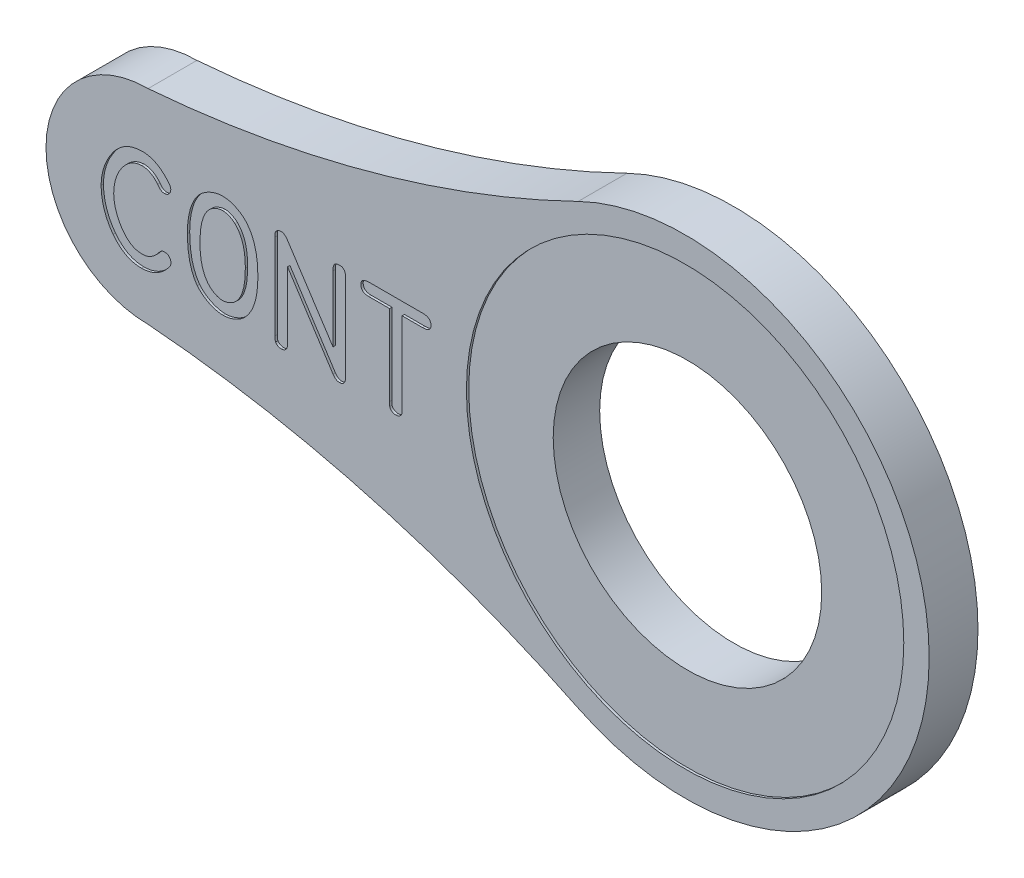
from build123d import *

# Parameters (mm, degrees)
BOSS_EXTRUDE1_DEPTH              = 1.5875
F_11_32_0_34375_DIAMETER_HOLE1_D = 8.73125
WRAP1_START                      = -0.0762
WRAP1_OUTLINE_R                  = 7.112
WRAP1_DEPTH                      = 0.0762


# Read off the part's stored shape, not the designer's step: Wrap1
with BuildPart() as part:
    # Sketch1 → Boss-Extrude1 (new body)
    with BuildSketch(Plane.XY):
        with BuildLine():
            ThreePointArc((-3.478640359, -7.13463156), (7.9375, 0), (-3.478640359, 7.13463156))
            ThreePointArc((-3.478640359, 7.13463156), (-10.291365431, 4.570684756), (-17.4625, 3.320934733))
            ThreePointArc((-17.4625, 3.320934733), (-20.783434733, 0), (-17.4625, -3.320934733))
            ThreePointArc((-17.4625, -3.320934733), (-10.291365431, -4.570684756), (-3.478640359, -7.13463156))
        make_face()
    extrude(amount=BOSS_EXTRUDE1_DEPTH)

    # 11/32 (0.34375) Diameter Hole1 (through all)
    with Locations(Plane.XY.offset(1.5875)):
        with Locations((0, 0)):
            Hole(F_11_32_0_34375_DIAMETER_HOLE1_D / 2)

    # Wrap1 outline → Wrap1 (cut)
    # profile 1 of 5: a face of its own
    with BuildSketch(Plane.XY.offset(1.5875).offset(WRAP1_START)):
        with BuildLine():
            Line((-9.202524652, 1.051753066), (-8.53708701, 1.051753066))
            add(Edge.make_bspline(
                [(-8.53708701, 1.051753066), (-8.515550018, 1.051915675), (-8.475328705, 1.052219355), (-8.419049158, 1.060872222), (-8.371032058, 1.075239414), (-8.331569886, 1.097349422), (-8.300354923, 1.12553967), (-8.279017568, 1.161093566), (-8.26539795, 1.202370334), (-8.26463823, 1.232205427), (-8.264238858, 1.247889249)],
                knots=[0, 0, 0, 0, 0.168067011, 0.313872781, 0.443458735, 0.557405365, 0.664641403, 0.767970584, 0.878025924, 1, 1, 1, 1], degree=3))
            add(Edge.make_bspline(
                [(-8.264238858, 1.247889249), (-8.264893612, 1.264540266), (-8.266131504, 1.296021014), (-8.28003294, 1.339524592), (-8.299700008, 1.377589847), (-8.329830253, 1.407446153), (-8.366946634, 1.431227712), (-8.412175956, 1.447111159), (-8.464950449, 1.457317493), (-8.502705889, 1.458486652), (-8.522878128, 1.459111319)],
                knots=[0, 0, 0, 0, 0.130829317, 0.247348531, 0.357249001, 0.465448022, 0.577582241, 0.702495907, 0.841047445, 1, 1, 1, 1], degree=3))
            Line((-8.522878128, 1.459111319), (-10.256174477, 1.459829059))
            add(Edge.make_bspline(
                [(-10.256174477, 1.459829059), (-10.279308935, 1.459458193), (-10.322345611, 1.458768276), (-10.38227943, 1.4492251), (-10.432909611, 1.434823941), (-10.4751074, 1.413881726), (-10.507422814, 1.385302272), (-10.53095215, 1.350355784), (-10.543077181, 1.30828783), (-10.544058157, 1.278613473), (-10.544575084, 1.262976539)],
                knots=[0, 0, 0, 0, 0.174047069, 0.323777098, 0.455577296, 0.569309267, 0.675345542, 0.776884897, 0.882429264, 1, 1, 1, 1], degree=3))
            add(Edge.make_bspline(
                [(-10.544575084, 1.262976539), (-10.543924243, 1.246321315), (-10.54269375, 1.214832614), (-10.52874239, 1.1713827), (-10.509171864, 1.132978801), (-10.477963384, 1.103515735), (-10.440654723, 1.078762484), (-10.394203818, 1.062999), (-10.340502442, 1.052886355), (-10.302036749, 1.051677499), (-10.28162516, 1.051036027)],
                knots=[0, 0, 0, 0, 0.129366599, 0.244583087, 0.353254832, 0.461556752, 0.575018765, 0.700288751, 0.840960023, 1, 1, 1, 1], degree=3))
            Line((-10.28162516, 1.051036027), (-9.610600646, 1.051753066))
            Line((-9.610600646, 1.051753066), (-9.610600646, -1.568406422))
            add(Edge.make_bspline(
                [(-9.610600646, -1.568406422), (-9.61100062, -1.586606868), (-9.611647988, -1.616064718), (-9.610866735, -1.653435693), (-9.609490915, -1.680557232), (-9.607358438, -1.696298511), (-9.60628929, -1.704190635)],
                knots=[0, 0, 0, 0, 0.401466725, 0.649783319, 0.824413653, 1, 1, 1, 1], degree=3))
            add(Edge.make_bspline(
                [(-9.60628929, -1.704190635), (-9.603089556, -1.714182972), (-9.596734889, -1.734027739), (-9.580246233, -1.760698083), (-9.559919756, -1.785293521), (-9.533956129, -1.805296808), (-9.505556157, -1.822938504), (-9.47426179, -1.834797489), (-9.441496803, -1.843365258), (-9.418833316, -1.844451594), (-9.407280741, -1.845005348)],
                knots=[0, 0, 0, 0, 0.120074955, 0.238468683, 0.357499627, 0.484642859, 0.61294102, 0.740113996, 0.86752468, 1, 1, 1, 1], degree=3))
            add(Edge.make_bspline(
                [(-9.407280741, -1.845005348), (-9.386942204, -1.843746436), (-9.348477267, -1.841365539), (-9.295700882, -1.820054711), (-9.251981831, -1.786124095), (-9.232566335, -1.755201893), (-9.22264104, -1.739394313)],
                knots=[0, 0, 0, 0, 0.271625149, 0.513706786, 0.751404547, 1, 1, 1, 1], degree=3))
            add(Edge.make_bspline(
                [(-9.22264104, -1.739394313), (-9.219316893, -1.731083917), (-9.212515912, -1.714081409), (-9.205523371, -1.683940797), (-9.202349682, -1.643427012), (-9.202459113, -1.612233038), (-9.202524652, -1.593550503)],
                knots=[0, 0, 0, 0, 0.180688297, 0.369676007, 0.622489591, 1, 1, 1, 1], degree=3))
            Line((-9.202524652, -1.593550503), (-9.202524652, 1.051753066))
        make_face()
    # profile 2 of 5: a face of its own
    with BuildSketch(Plane.XY.offset(1.5875).offset(WRAP1_START)):
        with BuildLine():
            Line((-11.44981393, -0.948170314), (-12.931825222, 1.318568828))
            add(Edge.make_bspline(
                [(-12.931825222, 1.318568828), (-12.940589719, 1.330796084), (-12.957179417, 1.353940196), (-12.98271477, 1.384999231), (-13.008066312, 1.409799472), (-13.040381971, 1.434876863), (-13.085432524, 1.456682688), (-13.124225901, 1.4582941), (-13.143899741, 1.459111319)],
                knots=[0, 0, 0, 0, 0.169217477, 0.320299826, 0.451756639, 0.567066417, 0.780440194, 1, 1, 1, 1], degree=3))
            add(Edge.make_bspline(
                [(-13.143899741, 1.459111319), (-13.163887087, 1.457517392), (-13.20393875, 1.4543234), (-13.257051044, 1.426740047), (-13.302863893, 1.389971811), (-13.318195928, 1.355303392), (-13.325665672, 1.338412993)],
                knots=[0, 0, 0, 0, 0.25722592, 0.515442432, 0.76392431, 1, 1, 1, 1], degree=3))
            add(Edge.make_bspline(
                [(-13.325665672, 1.338412993), (-13.327802389, 1.331276071), (-13.332226757, 1.316498091), (-13.335017217, 1.289377591), (-13.334887678, 1.251483769), (-13.335407705, 1.221546693), (-13.335723866, 1.203345819)],
                knots=[0, 0, 0, 0, 0.164010857, 0.3396071, 0.598500264, 1, 1, 1, 1], degree=3))
            Line((-13.335723866, 1.203345819), (-13.335006125, -1.578654048))
            add(Edge.make_bspline(
                [(-13.335006125, -1.578654048), (-13.334924832, -1.599900828), (-13.334787539, -1.635784038), (-13.332847273, -1.682457977), (-13.326155213, -1.716790968), (-13.318961094, -1.73563777), (-13.315607478, -1.74442341)],
                knots=[0, 0, 0, 0, 0.37923184, 0.640476136, 0.832404082, 1, 1, 1, 1], degree=3))
            add(Edge.make_bspline(
                [(-13.315607478, -1.74442341), (-13.305337669, -1.75923107), (-13.285266537, -1.788170895), (-13.242138746, -1.820064989), (-13.190791083, -1.840183766), (-13.153435892, -1.84334641), (-13.133841547, -1.845005348)],
                knots=[0, 0, 0, 0, 0.24768333, 0.484067853, 0.72937223, 1, 1, 1, 1], degree=3))
            add(Edge.make_bspline(
                [(-13.133841547, -1.845005348), (-13.118204476, -1.844146801), (-13.088385203, -1.842509585), (-13.046600356, -1.831078094), (-13.010965664, -1.811673133), (-12.980622134, -1.78576503), (-12.958339481, -1.750949311), (-12.940808221, -1.710310656), (-12.93040882, -1.662034936), (-12.928135159, -1.627604282), (-12.926930132, -1.609356236)],
                knots=[0, 0, 0, 0, 0.132129688, 0.251966061, 0.362463643, 0.472905592, 0.58518714, 0.70851143, 0.845512762, 1, 1, 1, 1], degree=3))
            Line((-12.926930132, -1.609356236), (-12.926930132, 0.567992953))
            Line((-12.926930132, 0.567992953), (-11.44981393, -1.713757706))
            add(Edge.make_bspline(
                [(-11.44981393, -1.713757706), (-11.435184705, -1.734419327), (-11.407891066, -1.772967563), (-11.354900443, -1.815211404), (-11.298264396, -1.842302473), (-11.258266577, -1.844114137), (-11.238590456, -1.845005348)],
                knots=[0, 0, 0, 0, 0.290623159, 0.542213511, 0.774801158, 1, 1, 1, 1], degree=3))
            add(Edge.make_bspline(
                [(-11.238590456, -1.845005348), (-11.223661629, -1.844414366), (-11.195281623, -1.843290898), (-11.155398509, -1.832127079), (-11.120799922, -1.81432708), (-11.092640303, -1.788048603), (-11.070578588, -1.754584748), (-11.055318724, -1.713812016), (-11.045137794, -1.666349537), (-11.043385767, -1.632405196), (-11.042455677, -1.614385333)],
                knots=[0, 0, 0, 0, 0.129823068, 0.246796295, 0.357906111, 0.465732929, 0.578612523, 0.704188565, 0.842964052, 1, 1, 1, 1], degree=3))
            Line((-11.042455677, -1.614385333), (-11.041737936, 1.213488205))
            add(Edge.make_bspline(
                [(-11.041737936, 1.213488205), (-11.042138412, 1.233384491), (-11.042891994, 1.27082367), (-11.05228117, 1.322795886), (-11.066866688, 1.367348024), (-11.089155011, 1.403327293), (-11.118817523, 1.43067617), (-11.154652348, 1.449467633), (-11.197316135, 1.459815421), (-11.22751761, 1.459356169), (-11.243619553, 1.459111319)],
                knots=[0, 0, 0, 0, 0.162079845, 0.3049884, 0.429154783, 0.542410064, 0.646080047, 0.75442866, 0.869073422, 1, 1, 1, 1], degree=3))
            add(Edge.make_bspline(
                [(-11.243619553, 1.459111319), (-11.260685594, 1.45880431), (-11.292826896, 1.458226107), (-11.33754185, 1.447563672), (-11.375012827, 1.428782376), (-11.404352746, 1.400597182), (-11.426614501, 1.363554145), (-11.441056811, 1.316341602), (-11.449187093, 1.258952876), (-11.450059317, 1.217266337), (-11.450530969, 1.19472451)],
                knots=[0, 0, 0, 0, 0.130999231, 0.246717201, 0.350532776, 0.449563782, 0.555402612, 0.679484004, 0.826682279, 1, 1, 1, 1], degree=3))
            Line((-11.450530969, 1.19472451), (-11.44981393, -0.948170314))
        make_face()
    # profile 3 of 5: a face of its own
    with BuildSketch(Plane.XY.offset(1.5875).offset(WRAP1_START)):
        with BuildLine():
            add(Edge.make_bspline(
                [(-15.036632775, 1.505809374), (-15.070106655, 1.504095288), (-15.137340169, 1.500652484), (-15.23845175, 1.482880931), (-15.339489458, 1.453698224), (-15.440472315, 1.415317801), (-15.537725497, 1.366849861), (-15.629728194, 1.310282015), (-15.715643109, 1.246859509), (-15.767157461, 1.198138737), (-15.792796925, 1.17388968)],
                knots=[0, 0, 0, 0, 0.118899942, 0.238814893, 0.363411662, 0.491768315, 0.621792008, 0.748493912, 0.874821655, 1, 1, 1, 1], degree=3))
            add(Edge.make_bspline(
                [(-15.792796925, 1.17388968), (-15.824196271, 1.136297969), (-15.888101154, 1.059790198), (-15.96711017, 0.9289993), (-16.035242394, 0.784898473), (-16.089929938, 0.626450332), (-16.132563129, 0.454930095), (-16.16416181, 0.271528205), (-16.182823353, 0.07625669), (-16.18525511, -0.057719217), (-16.186503369, -0.126491091)],
                knots=[0, 0, 0, 0, 0.105704853, 0.215133666, 0.329018149, 0.449630503, 0.576639017, 0.710540967, 0.851416267, 1, 1, 1, 1], degree=3))
            add(Edge.make_bspline(
                [(-16.186503369, -0.126491091), (-16.185595779, -0.19620849), (-16.18383447, -0.33150512), (-16.16864541, -0.527744086), (-16.143787965, -0.711107931), (-16.108983334, -0.881428841), (-16.064108245, -1.038780437), (-16.008327006, -1.182647694), (-15.944147127, -1.314544521), (-15.890713285, -1.393416663), (-15.864641167, -1.43190096)],
                knots=[0, 0, 0, 0, 0.153123595, 0.29715834, 0.432036511, 0.559346103, 0.678716767, 0.790963146, 0.898004084, 1, 1, 1, 1], degree=3))
            add(Edge.make_bspline(
                [(-15.864641167, -1.43190096), (-15.839238006, -1.461324724), (-15.78806747, -1.520594109), (-15.697538029, -1.597813891), (-15.597858578, -1.668058077), (-15.489091654, -1.729026136), (-15.375083079, -1.778993999), (-15.258870459, -1.814953006), (-15.143121697, -1.839345731), (-15.065370021, -1.8431332), (-15.026937311, -1.845005348)],
                knots=[0, 0, 0, 0, 0.121113158, 0.243962752, 0.369981284, 0.501104923, 0.632262609, 0.757496982, 0.880130582, 1, 1, 1, 1], degree=3))
            add(Edge.make_bspline(
                [(-15.026937311, -1.845005348), (-14.996450526, -1.844069047), (-14.934873309, -1.842177904), (-14.842789511, -1.825564992), (-14.749580704, -1.8034694), (-14.657679799, -1.769710734), (-14.567428109, -1.72981892), (-14.483078627, -1.680190575), (-14.402614468, -1.62612315), (-14.354737487, -1.583353029), (-14.330766611, -1.561939037)],
                knots=[0, 0, 0, 0, 0.118980861, 0.240317575, 0.36464631, 0.492760248, 0.622124838, 0.749523021, 0.874592076, 1, 1, 1, 1], degree=3))
            add(Edge.make_bspline(
                [(-14.330766611, -1.561939037), (-14.295461599, -1.523766562), (-14.223803873, -1.446288814), (-14.13434984, -1.311661603), (-14.058491027, -1.161888406), (-13.998059721, -0.995915865), (-13.949686146, -0.81496694), (-13.916849813, -0.617935519), (-13.89643479, -0.405442243), (-13.894325558, -0.258494786), (-13.89323518, -0.1825296)],
                knots=[0, 0, 0, 0, 0.104917106, 0.212947712, 0.325253939, 0.443443112, 0.569142725, 0.70317811, 0.846556515, 1, 1, 1, 1], degree=3))
            add(Edge.make_bspline(
                [(-13.89323518, -0.1825296), (-13.893468436, -0.140377408), (-13.893925847, -0.057717441), (-13.898767894, 0.06380333), (-13.908358295, 0.180465157), (-13.920863765, 0.292469121), (-13.938255267, 0.399567011), (-13.959135491, 0.501900168), (-13.983177766, 0.599658755), (-14.012079606, 0.692368834), (-14.044337208, 0.780183836), (-14.080270792, 0.863331253), (-14.120489614, 0.941491539), (-14.164433858, 1.015305609), (-14.212496783, 1.084191231), (-14.26438489, 1.148243812), (-14.319614174, 1.207872404), (-14.360134783, 1.243204133), (-14.380339137, 1.260821212)],
                knots=[0, 0, 0, 0, 0.0804244, 0.157711328, 0.231971506, 0.3037251, 0.372684803, 0.438907744, 0.502962369, 0.564674628, 0.624090994, 0.681389387, 0.737383029, 0.79168822, 0.84517995, 0.897487651, 0.948885373, 1, 1, 1, 1], degree=3))
            add(Edge.make_bspline(
                [(-14.380339137, 1.260821212), (-14.404723958, 1.279420177), (-14.453158678, 1.316362654), (-14.530608797, 1.364576409), (-14.611300266, 1.406440487), (-14.69496517, 1.441378476), (-14.78018925, 1.469529893), (-14.865775657, 1.489568612), (-14.951350648, 1.502476748), (-15.008452579, 1.504220168), (-15.036995505, 1.505091633)],
                knots=[0, 0, 0, 0, 0.128897167, 0.256023952, 0.383031035, 0.510762582, 0.636864263, 0.759967113, 0.880017352, 1, 1, 1, 1], degree=3))
            Line((-15.036995505, 1.505091633), (-15.036632775, 1.505809374))
        make_face()
        with BuildLine():
            add(Edge.make_bspline(
                [(-15.036632775, 1.097733381), (-15.019946285, 1.096924157), (-14.985737576, 1.095265181), (-14.934245521, 1.085248218), (-14.881090386, 1.071161363), (-14.810749331, 1.042964293), (-14.725561492, 1.000906113), (-14.667424059, 0.95303955), (-14.638978407, 0.929619259)],
                knots=[0, 0, 0, 0, 0.113760033, 0.233217626, 0.356799435, 0.48808984, 0.749531113, 1, 1, 1, 1], degree=3))
            add(Edge.make_bspline(
                [(-14.638978407, 0.929619259), (-14.611495338, 0.901399489), (-14.555599995, 0.844005835), (-14.486986934, 0.741523846), (-14.428418418, 0.62592099), (-14.38053689, 0.496234984), (-14.344337024, 0.352373028), (-14.319138847, 0.19490224), (-14.30279862, 0.023530241), (-14.301819038, -0.095557635), (-14.301310472, -0.157384115)],
                knots=[0, 0, 0, 0, 0.100864939, 0.205140138, 0.314753714, 0.432734862, 0.558926534, 0.694652539, 0.841473711, 1, 1, 1, 1], degree=3))
            add(Edge.make_bspline(
                [(-14.301310472, -0.157384115), (-14.302159729, -0.217511994), (-14.303792464, -0.333110487), (-14.315538948, -0.499457624), (-14.336876023, -0.651432384), (-14.366761062, -0.78966761), (-14.405663968, -0.91496683), (-14.452651606, -1.02861518), (-14.509826398, -1.130312675), (-14.556552119, -1.1895998), (-14.579347686, -1.218523562)],
                knots=[0, 0, 0, 0, 0.16117406, 0.309864224, 0.446676706, 0.572217453, 0.688558244, 0.79788685, 0.901397265, 1, 1, 1, 1], degree=3))
            add(Edge.make_bspline(
                [(-14.579347686, -1.218523562), (-14.594625476, -1.234158342), (-14.625257975, -1.26550662), (-14.676853296, -1.30730371), (-14.732848745, -1.34465004), (-14.792522428, -1.376669576), (-14.85402782, -1.402169105), (-14.915309362, -1.422265507), (-14.976448709, -1.433937496), (-15.017074663, -1.435945457), (-15.036995505, -1.436930056)],
                knots=[0, 0, 0, 0, 0.125982952, 0.252600203, 0.382070173, 0.51368077, 0.642441633, 0.765615, 0.885069867, 1, 1, 1, 1], degree=3))
            add(Edge.make_bspline(
                [(-15.036995505, -1.436930056), (-15.060083368, -1.436005817), (-15.106508191, -1.434147366), (-15.175178902, -1.417478048), (-15.244308051, -1.39502002), (-15.311711123, -1.36161924), (-15.376729511, -1.321266593), (-15.436655127, -1.273209971), (-15.491932183, -1.219502678), (-15.523371887, -1.178699366), (-15.539186753, -1.158174399)],
                knots=[0, 0, 0, 0, 0.116304108, 0.233863029, 0.354988023, 0.482524504, 0.612268418, 0.740398786, 0.869414858, 1, 1, 1, 1], degree=3))
            add(Edge.make_bspline(
                [(-15.539186753, -1.158174399), (-15.559112948, -1.128687603), (-15.599815713, -1.068455625), (-15.647690534, -0.967072984), (-15.689853654, -0.857054798), (-15.722582173, -0.735900528), (-15.74740662, -0.603745835), (-15.765099364, -0.45928857), (-15.775825883, -0.302193972), (-15.777066701, -0.193084629), (-15.777709635, -0.136549285)],
                knots=[0, 0, 0, 0, 0.100043733, 0.204356952, 0.314658206, 0.431427524, 0.557025968, 0.692897545, 0.840873914, 1, 1, 1, 1], degree=3))
            add(Edge.make_bspline(
                [(-15.777709635, -0.136549285), (-15.776662111, -0.079528439), (-15.774629955, 0.031089896), (-15.761353849, 0.191505808), (-15.737729101, 0.340875378), (-15.704889936, 0.478773041), (-15.664092933, 0.604486929), (-15.613811322, 0.715945234), (-15.555343906, 0.813242237), (-15.507651391, 0.867954332), (-15.484585129, 0.89441558)],
                knots=[0, 0, 0, 0, 0.156125124, 0.302876976, 0.440321746, 0.569779775, 0.690666127, 0.801586811, 0.904038388, 1, 1, 1, 1], degree=3))
            add(Edge.make_bspline(
                [(-15.484585129, 0.89441558), (-15.469758465, 0.908832522), (-15.439745305, 0.938016294), (-15.389377896, 0.976907616), (-15.333462159, 1.0103064), (-15.274669662, 1.040515192), (-15.213661012, 1.06438851), (-15.153451746, 1.082669927), (-15.094637434, 1.093918486), (-15.055958196, 1.095997228), (-15.036995505, 1.097016341)],
                knots=[0, 0, 0, 0, 0.123361766, 0.249717432, 0.3786496, 0.51159882, 0.643769854, 0.769029542, 0.886765568, 1, 1, 1, 1], degree=3))
            Line((-15.036995505, 1.097016341), (-15.036632775, 1.097733381))
        make_face(mode=Mode.SUBTRACT)
    # profile 4 of 5: a face of its own
    with BuildSketch(Plane.XY.offset(1.5875).offset(WRAP1_START)):
        with BuildLine():
            add(Edge.make_bspline(
                [(-17.653875696, 1.459829059), (-17.698871142, 1.457881043), (-17.787317566, 1.454051877), (-17.91738129, 1.43242534), (-18.041342523, 1.395301129), (-18.16037574, 1.345006121), (-18.273020373, 1.278862033), (-18.379537987, 1.198368946), (-18.481463474, 1.10445732), (-18.542076641, 1.0325843), (-18.573169071, 0.995715961)],
                knots=[0, 0, 0, 0, 0.126561381, 0.248778543, 0.369585115, 0.489659411, 0.611274038, 0.735850368, 0.8645005, 1, 1, 1, 1], degree=3))
            add(Edge.make_bspline(
                [(-18.573169071, 0.995715961), (-18.605231416, 0.952607809), (-18.669122847, 0.866705123), (-18.752256181, 0.7299259), (-18.823634909, 0.58784135), (-18.88312807, 0.441511409), (-18.930831042, 0.291926245), (-18.965254915, 0.140312398), (-18.987026598, -0.01282761), (-18.989876662, -0.115404416), (-18.991302557, -0.166723867)],
                knots=[0, 0, 0, 0, 0.128110482, 0.255288942, 0.381247665, 0.507070276, 0.631739752, 0.755364191, 0.877608049, 1, 1, 1, 1], degree=3))
            add(Edge.make_bspline(
                [(-18.991302557, -0.166723867), (-18.989698901, -0.220893229), (-18.986510756, -0.328584521), (-18.967726614, -0.488701706), (-18.93559554, -0.645590771), (-18.893053715, -0.799354095), (-18.837457423, -0.947887228), (-18.771424132, -1.090568268), (-18.694073563, -1.226587321), (-18.633113611, -1.310769547), (-18.60262521, -1.352872294)],
                knots=[0, 0, 0, 0, 0.128002322, 0.254474762, 0.380312741, 0.506069279, 0.631036662, 0.754573973, 0.877253069, 1, 1, 1, 1], degree=3))
            add(Edge.make_bspline(
                [(-18.60262521, -1.352872294), (-18.570801837, -1.392090095), (-18.508760344, -1.468547448), (-18.405443268, -1.569474684), (-18.297332743, -1.655217607), (-18.183594826, -1.724662309), (-18.06493138, -1.779549143), (-17.940600298, -1.81713802), (-17.811374175, -1.841447375), (-17.72336296, -1.843807752), (-17.678708265, -1.845005348)],
                knots=[0, 0, 0, 0, 0.1392776, 0.271529677, 0.397654474, 0.519268091, 0.638444037, 0.757385218, 0.876903312, 1, 1, 1, 1], degree=3))
            add(Edge.make_bspline(
                [(-17.678708265, -1.845005348), (-17.640567868, -1.843916731), (-17.565087781, -1.841762351), (-17.453978138, -1.824110649), (-17.347308389, -1.795000061), (-17.244399691, -1.756344872), (-17.146119518, -1.70560087), (-17.052555299, -1.643263047), (-16.962721558, -1.570408759), (-16.907791941, -1.514826703), (-16.879800299, -1.486502583)],
                knots=[0, 0, 0, 0, 0.126830023, 0.250997416, 0.373134294, 0.494164515, 0.616020462, 0.740198077, 0.867607259, 1, 1, 1, 1], degree=3))
            add(Edge.make_bspline(
                [(-16.879800299, -1.486502583), (-16.865603052, -1.470996727), (-16.839249156, -1.442213701), (-16.803489916, -1.401219787), (-16.775360255, -1.364716881), (-16.748614411, -1.324342752), (-16.724549799, -1.278551357), (-16.721639827, -1.240345376), (-16.720306083, -1.222834217)],
                knots=[0, 0, 0, 0, 0.200214718, 0.371652177, 0.518084007, 0.638274312, 0.834208255, 1, 1, 1, 1], degree=3))
            add(Edge.make_bspline(
                [(-16.720306083, -1.222834217), (-16.721234911, -1.207684914), (-16.723014619, -1.17865765), (-16.733735983, -1.13745506), (-16.752118888, -1.101790722), (-16.77621357, -1.070994791), (-16.805456815, -1.045945093), (-16.839595489, -1.027207939), (-16.878232778, -1.01660072), (-16.905363251, -1.014729643), (-16.919314632, -1.013767474)],
                knots=[0, 0, 0, 0, 0.14084164, 0.269863728, 0.392287082, 0.511159391, 0.63113076, 0.747646428, 0.870231504, 1, 1, 1, 1], degree=3))
            add(Edge.make_bspline(
                [(-16.919314632, -1.013767474), (-16.938379982, -1.01440552), (-16.973793735, -1.015590685), (-17.024122222, -1.033306749), (-17.067334823, -1.067199098), (-17.090527096, -1.097194324), (-17.10323589, -1.11363097)],
                knots=[0, 0, 0, 0, 0.259798253, 0.482573418, 0.716462968, 1, 1, 1, 1], degree=3))
            add(Edge.make_bspline(
                [(-17.10323589, -1.11363097), (-17.12390444, -1.139596243), (-17.163880801, -1.189817333), (-17.22858238, -1.257229882), (-17.295711406, -1.313236968), (-17.363472419, -1.360263671), (-17.433771209, -1.396021647), (-17.505972682, -1.420173487), (-17.579606823, -1.435752213), (-17.629297056, -1.43653598), (-17.654281223, -1.436930056)],
                knots=[0, 0, 0, 0, 0.149863651, 0.289860841, 0.421162578, 0.54417748, 0.66173484, 0.77599087, 0.887368583, 1, 1, 1, 1], degree=3))
            add(Edge.make_bspline(
                [(-17.654281223, -1.436930056), (-17.681157304, -1.436680069), (-17.734251992, -1.436186211), (-17.812522334, -1.423082585), (-17.888277555, -1.402819786), (-17.960745977, -1.371725977), (-18.030669148, -1.333182664), (-18.097077455, -1.284762602), (-18.161725737, -1.228866168), (-18.200522051, -1.185459255), (-18.220413846, -1.163203496)],
                knots=[0, 0, 0, 0, 0.123712287, 0.244398171, 0.364644047, 0.48437199, 0.606921472, 0.731907662, 0.862542669, 1, 1, 1, 1], degree=3))
            add(Edge.make_bspline(
                [(-18.220413846, -1.163203496), (-18.247926723, -1.129225387), (-18.302841891, -1.061405743), (-18.373225809, -0.949951692), (-18.435198514, -0.832083854), (-18.487355578, -0.707563522), (-18.528820822, -0.57893294), (-18.558891885, -0.448676429), (-18.578663753, -0.317956214), (-18.581228621, -0.230494828), (-18.582508823, -0.186840254)],
                knots=[0, 0, 0, 0, 0.123429024, 0.246361926, 0.371653552, 0.499321281, 0.627273753, 0.752990311, 0.876710134, 1, 1, 1, 1], degree=3))
            add(Edge.make_bspline(
                [(-18.582508823, -0.186840254), (-18.580734223, -0.145359878), (-18.577246117, -0.063827151), (-18.561461006, 0.055857046), (-18.539806068, 0.171324232), (-18.508690949, 0.28200302), (-18.469943482, 0.38801657), (-18.422940122, 0.489120526), (-18.368136801, 0.585685263), (-18.306317308, 0.676891284), (-18.238464393, 0.760466779), (-18.167027355, 0.834832447), (-18.091453991, 0.897895267), (-18.013208718, 0.951144932), (-17.930474499, 0.991995792), (-17.845115005, 1.023408059), (-17.756013738, 1.044100593), (-17.695097682, 1.048709073), (-17.664339416, 1.051036027)],
                knots=[0, 0, 0, 0, 0.073672336, 0.144808387, 0.214096098, 0.2820723, 0.348651491, 0.414273642, 0.47976759, 0.545565782, 0.609639631, 0.670672314, 0.728317869, 0.784090924, 0.838277769, 0.891671609, 0.945301885, 1, 1, 1, 1], degree=3))
            add(Edge.make_bspline(
                [(-17.664339416, 1.051036027), (-17.640330855, 1.050219498), (-17.592443264, 1.048590845), (-17.522283105, 1.035154319), (-17.454055808, 1.014278481), (-17.38888643, 0.983782549), (-17.325669798, 0.94505718), (-17.264559346, 0.898579606), (-17.206662899, 0.842294625), (-17.171137127, 0.800374224), (-17.152808417, 0.778746352)],
                knots=[0, 0, 0, 0, 0.119872999, 0.239099261, 0.355665866, 0.475592602, 0.597490966, 0.725530412, 0.858393692, 1, 1, 1, 1], degree=3))
            add(Edge.make_bspline(
                [(-17.152808417, 0.778746352), (-17.142286377, 0.76487758), (-17.122739369, 0.739113277), (-17.09195272, 0.706493926), (-17.066020476, 0.679017033), (-17.033383626, 0.65388007), (-16.988160008, 0.632948323), (-16.949518388, 0.631973746), (-16.929372826, 0.631465656)],
                knots=[0, 0, 0, 0, 0.186219864, 0.345944463, 0.48011979, 0.589873366, 0.786183086, 1, 1, 1, 1], degree=3))
            add(Edge.make_bspline(
                [(-16.929372826, 0.631465656), (-16.915402141, 0.632626006), (-16.887893173, 0.634910793), (-16.848804739, 0.647102302), (-16.813925205, 0.667469703), (-16.783480389, 0.693743472), (-16.757817106, 0.725415432), (-16.740184252, 0.761936806), (-16.727779988, 0.801672587), (-16.726168443, 0.829655701), (-16.72533518, 0.844124611)],
                knots=[0, 0, 0, 0, 0.128479842, 0.252983143, 0.372187669, 0.496943218, 0.620588941, 0.743528559, 0.867389233, 1, 1, 1, 1], degree=3))
            add(Edge.make_bspline(
                [(-16.72533518, 0.844124611), (-16.725978918, 0.859581079), (-16.727237059, 0.889789682), (-16.743686666, 0.935451748), (-16.774227754, 0.982013703), (-16.800378226, 1.01327325), (-16.815140482, 1.030919639)],
                knots=[0, 0, 0, 0, 0.217330624, 0.424757763, 0.675268845, 1, 1, 1, 1], degree=3))
            add(Edge.make_bspline(
                [(-16.815140482, 1.030919639), (-16.84562411, 1.065083188), (-16.905034088, 1.131665017), (-17.002877433, 1.218564952), (-17.102722557, 1.293305283), (-17.20632315, 1.354563311), (-17.313754571, 1.401480726), (-17.424524949, 1.434453068), (-17.538276345, 1.455698213), (-17.615391413, 1.457967099), (-17.654281223, 1.459111319)],
                knots=[0, 0, 0, 0, 0.14097093, 0.274740262, 0.402394868, 0.524768812, 0.644718424, 0.762605448, 0.880279831, 1, 1, 1, 1], degree=3))
            Line((-17.654281223, 1.459111319), (-17.653875696, 1.459829059))
        make_face()
    # profile 5 of 5: a face of its own
    with BuildSketch(Plane.XY.offset(1.5875).offset(WRAP1_START)):
        Circle(WRAP1_OUTLINE_R)
    extrude(amount=WRAP1_DEPTH, mode=Mode.SUBTRACT)


solid = part.part
